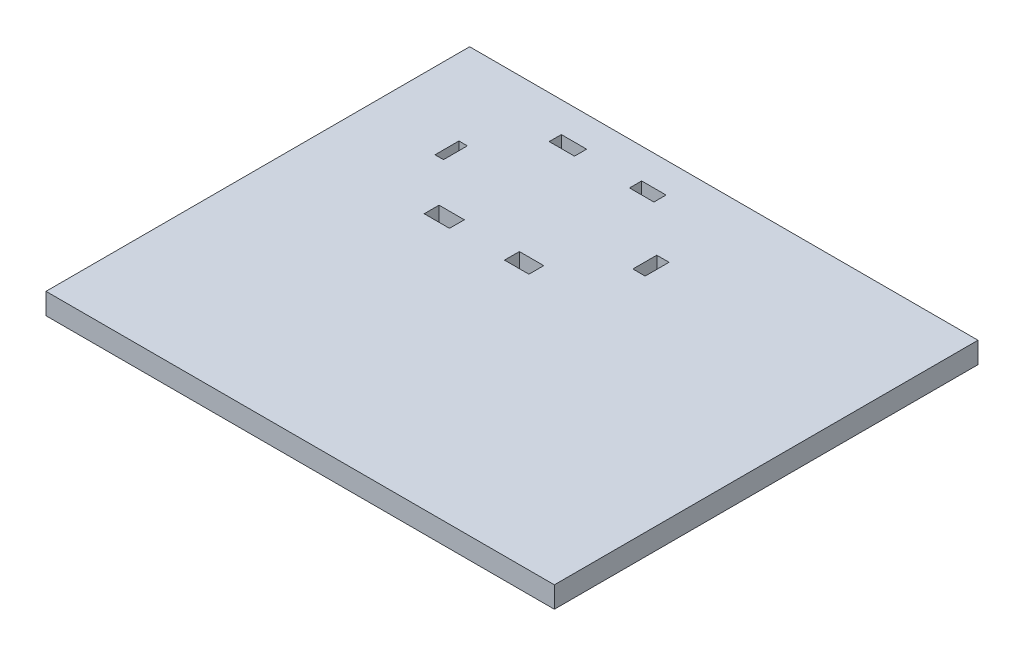
from build123d import *

# Parameters (mm, degrees)
SKETCH1_W           = 120
SKETCH1_H           = 100
BOSS_EXTRUDE1_DEPTH = 5
CUT_EXTRUDE3_REACH  = 89.53
SKETCH2_W           = 5.971575727
SKETCH2_H           = 3.507088365
SKETCH2_W_2         = 1.998257588
SKETCH2_H_2         = 5.641808254
SKETCH2_W_3         = 5.759345926
SKETCH2_H_3         = 2.869203803
SKETCH2_W_4         = 2.902639978


with BuildPart() as part:
    # Sketch1 → Boss-Extrude1 (new body)
    with BuildSketch(Plane(origin=(0, 0, 0), x_dir=(1, 0, 0), z_dir=(0, 1, 0))):
        with Locations((-8.809035242, 3.869047619)):
            Rectangle(SKETCH1_W, SKETCH1_H)
    extrude(amount=BOSS_EXTRUDE1_DEPTH)

    # Sketch2 → Cut-Extrude3 (cut, up to next)
    with BuildSketch(Plane(origin=(0, 5, 0), x_dir=(1, 0, 0), z_dir=(0, 1, 0)), mode=Mode.PRIVATE) as cut_extrude3_sk1:
        with Locations((-37.04605761, 16.115503436)):
            Rectangle(SKETCH2_W, SKETCH2_H)
    cut_extrude3_tool1 = extrude(cut_extrude3_sk1.sketch, amount=-CUT_EXTRUDE3_REACH, mode=Mode.PRIVATE) & part.part
    # Sketch2 → Cut-Extrude3 (cut, up to next)
    with BuildSketch(Plane(origin=(0, 5, 0), x_dir=(1, 0, 0), z_dir=(0, 1, 0)), mode=Mode.PRIVATE) as cut_extrude3_sk2:
        with Locations((-49.808164036, 30.518052692)):
            Rectangle(SKETCH2_W_2, SKETCH2_H_2)
    cut_extrude3_tool2 = extrude(cut_extrude3_sk2.sketch, amount=-CUT_EXTRUDE3_REACH, mode=Mode.PRIVATE) & part.part
    # Sketch2 → Cut-Extrude3 (cut, up to next)
    with BuildSketch(Plane(origin=(0, 5, 0), x_dir=(1, 0, 0), z_dir=(0, 1, 0)), mode=Mode.PRIVATE) as cut_extrude3_sk3:
        with Locations((-18.190588862, 16.115503436)):
            Rectangle(SKETCH2_W_3, SKETCH2_H)
    cut_extrude3_tool3 = extrude(cut_extrude3_sk3.sketch, amount=-CUT_EXTRUDE3_REACH, mode=Mode.PRIVATE) & part.part
    # Sketch2 → Cut-Extrude3 (cut, up to next)
    with BuildSketch(Plane(origin=(0, 5, 0), x_dir=(1, 0, 0), z_dir=(0, 1, 0)), mode=Mode.PRIVATE) as cut_extrude3_sk4:
        with Locations((-37.04605761, 45.303649521)):
            Rectangle(SKETCH2_W, SKETCH2_H_3)
    cut_extrude3_tool4 = extrude(cut_extrude3_sk4.sketch, amount=-CUT_EXTRUDE3_REACH, mode=Mode.PRIVATE) & part.part
    # Sketch2 → Cut-Extrude3 (cut, up to next)
    with BuildSketch(Plane(origin=(0, 5, 0), x_dir=(1, 0, 0), z_dir=(0, 1, 0)), mode=Mode.PRIVATE) as cut_extrude3_sk5:
        with Locations((-18.190588862, 45.303649521)):
            Rectangle(SKETCH2_W_3, SKETCH2_H_3)
    cut_extrude3_tool5 = extrude(cut_extrude3_sk5.sketch, amount=-CUT_EXTRUDE3_REACH, mode=Mode.PRIVATE) & part.part
    # Sketch2 → Cut-Extrude3 (cut, up to next)
    with BuildSketch(Plane(origin=(0, 5, 0), x_dir=(1, 0, 0), z_dir=(0, 1, 0)), mode=Mode.PRIVATE) as cut_extrude3_sk6:
        with Locations((-2.657715253, 30.518052692)):
            Rectangle(SKETCH2_W_4, SKETCH2_H_2)
    cut_extrude3_tool6 = extrude(cut_extrude3_sk6.sketch, amount=-CUT_EXTRUDE3_REACH, mode=Mode.PRIVATE) & part.part
    add(cut_extrude3_tool1.solids().sort_by_distance((-37.046058, 5, -16.115503))[0], mode=Mode.SUBTRACT)
    add(cut_extrude3_tool2.solids().sort_by_distance((-49.808164, 5, -30.518053))[0], mode=Mode.SUBTRACT)
    add(cut_extrude3_tool3.solids().sort_by_distance((-18.190589, 5, -16.115503))[0], mode=Mode.SUBTRACT)
    add(cut_extrude3_tool4.solids().sort_by_distance((-37.046058, 5, -45.30365))[0], mode=Mode.SUBTRACT)
    add(cut_extrude3_tool5.solids().sort_by_distance((-18.190589, 5, -45.30365))[0], mode=Mode.SUBTRACT)
    add(cut_extrude3_tool6.solids().sort_by_distance((-2.657715, 5, -30.518053))[0], mode=Mode.SUBTRACT)


solid = part.part
